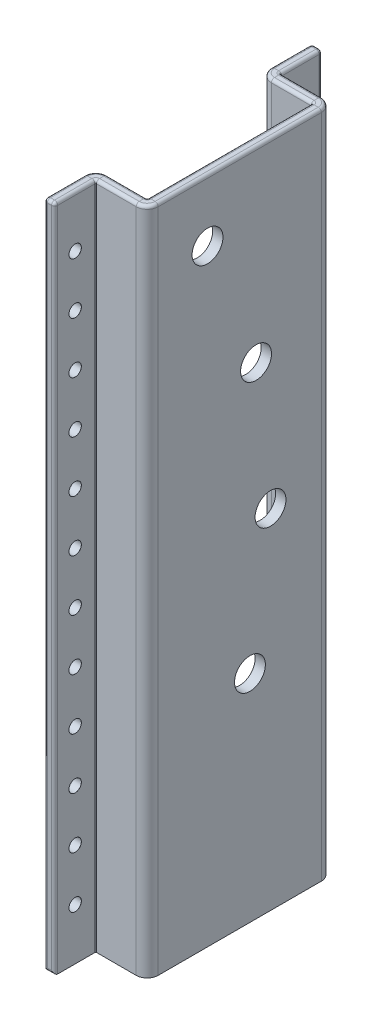
from build123d import *

# Parameters (mm, degrees)
SKETCH1_W                       = 180
SKETCH1_H                       = 650
BASE_FLANGE1_DEPTH              = 10
EDGE_FLANGE1_STRIP_W            = 41.4732
EDGE_FLANGE1_STRIP_H            = 10
EDGE_FLANGE1_STRIP_CUT_DEPTH    = 650
EDGE_FLANGE1_STRIP_2_W          = 41.4732
EDGE_FLANGE1_STRIP_2_H          = 10
EDGE_FLANGE1_STRIP_CUT_2_DEPTH  = 650
EDGE_FLANGE1_DEPTH              = 650
EDGE_FLANGE1_BEND_DEPTH         = 650
EDGE_FLANGE2_STRIP_W            = 41.4732
EDGE_FLANGE2_STRIP_H            = 10
EDGE_FLANGE2_STRIP_CUT_DEPTH    = 650
EDGE_FLANGE2_STRIP_2_W          = 41.4732
EDGE_FLANGE2_STRIP_2_H          = 10
EDGE_FLANGE2_STRIP_CUT_2_DEPTH  = 650
EDGE_FLANGE2_DEPTH              = 650
EDGE_FLANGE2_BEND_DEPTH         = 650
SKETCH18_R                      = 15
CUT_EXTRUDE1_DEPTH              = 10
M10_CLEARANCE_HOLE1_D           = 12
M10_CLEARANCE_HOLE1_CSINK_D     = 12.05
M10_CLEARANCE_HOLE1_CSINK_ANGLE = 90
FILLET1_R                       = 3


# Sheet-metal steps are written as plain solids
with BuildPart() as part:
    # Sketch1 → Base-Flange1 (new body)
    with BuildSketch(Plane(origin=(0, 0, 0), x_dir=(0, 0, -1), z_dir=(1, 0, 0))):
        Rectangle(SKETCH1_W, SKETCH1_H)
    extrude(amount=BASE_FLANGE1_DEPTH)

    # Edge-Flange1 strip (across the edge) → Edge-Flange1 strip cut (cut)
    with BuildSketch(Plane(origin=(0, -325, 90), x_dir=(0, 0, -1), z_dir=(0, 1, 0))):
        with Locations((-10, -5)):
            Rectangle(EDGE_FLANGE1_STRIP_W, EDGE_FLANGE1_STRIP_H)
    extrude(amount=EDGE_FLANGE1_STRIP_CUT_DEPTH, mode=Mode.SUBTRACT)

    # Edge-Flange1 strip 2 (across the edge) → Edge-Flange1 strip cut 2 (cut)
    with BuildSketch(Plane(origin=(0, 325, -90), x_dir=(0, 0, 1), z_dir=(0, -1, 0))):
        with Locations((-10, -5)):
            Rectangle(EDGE_FLANGE1_STRIP_2_W, EDGE_FLANGE1_STRIP_2_H)
    extrude(amount=EDGE_FLANGE1_STRIP_CUT_2_DEPTH, mode=Mode.SUBTRACT)

    # Edge-Flange1 section (across the edge) → Edge-Flange1 (add)
    with BuildSketch(Plane(origin=(0, -325, 90), x_dir=(0, 0, -1), z_dir=(0, 1, 0))):
        with BuildLine():
            Line((0, 0.7366), (0, 50))
            Line((0, 50), (10, 50))
            Line((10, 50), (10, 0.7366))
            ThreePointArc((10, 0.7366), (10.215745145, 0.215745145), (10.7366, 0))
            Line((10.7366, 0), (10.7366, -10))
            ThreePointArc((10.7366, -10), (3.144677333, -6.855322667), (0, 0.7366))
        make_face()
    extrude(amount=EDGE_FLANGE1_DEPTH)

    # Edge-Flange1 section 2 (across the edge) → Edge-Flange1 bend (add)
    with BuildSketch(Plane(origin=(0, 325, -90), x_dir=(0, 0, 1), z_dir=(0, -1, 0))):
        with BuildLine():
            Line((0, 0.7366), (0, 50))
            Line((0, 50), (10, 50))
            Line((10, 50), (10, 0.7366))
            ThreePointArc((10, 0.7366), (10.215745145, 0.215745145), (10.7366, 0))
            Line((10.7366, 0), (10.7366, -10))
            ThreePointArc((10.7366, -10), (3.144677333, -6.855322667), (0, 0.7366))
        make_face()
    extrude(amount=EDGE_FLANGE1_BEND_DEPTH)

    # Edge-Flange2 strip (across the edge) → Edge-Flange2 strip cut (cut)
    with BuildSketch(Plane(origin=(-50, 325, 90), x_dir=(1, 0, 0), z_dir=(0, -1, 0))):
        with Locations((-10, -5)):
            Rectangle(EDGE_FLANGE2_STRIP_W, EDGE_FLANGE2_STRIP_H)
    extrude(amount=EDGE_FLANGE2_STRIP_CUT_DEPTH, mode=Mode.SUBTRACT)

    # Edge-Flange2 strip 2 (across the edge) → Edge-Flange2 strip cut 2 (cut)
    with BuildSketch(Plane(origin=(-50, -325, -90), x_dir=(1, 0, 0), z_dir=(0, 1, 0))):
        with Locations((-10, -5)):
            Rectangle(EDGE_FLANGE2_STRIP_2_W, EDGE_FLANGE2_STRIP_2_H)
    extrude(amount=EDGE_FLANGE2_STRIP_CUT_2_DEPTH, mode=Mode.SUBTRACT)

    # Edge-Flange2 section (across the edge) → Edge-Flange2 (add)
    with BuildSketch(Plane(origin=(-50, 325, 90), x_dir=(1, 0, 0), z_dir=(0, -1, 0))):
        with BuildLine():
            Line((0, 0.7366), (0, 40))
            Line((0, 40), (10, 40))
            Line((10, 40), (10, 0.7366))
            ThreePointArc((10, 0.7366), (10.215745145, 0.215745145), (10.7366, 0))
            Line((10.7366, 0), (10.7366, -10))
            ThreePointArc((10.7366, -10), (3.144677333, -6.855322667), (0, 0.7366))
        make_face()
    extrude(amount=EDGE_FLANGE2_DEPTH)

    # Edge-Flange2 section 2 (across the edge) → Edge-Flange2 bend (add)
    with BuildSketch(Plane(origin=(-50, -325, -90), x_dir=(1, 0, 0), z_dir=(0, 1, 0))):
        with BuildLine():
            Line((0, 0.7366), (0, 40))
            Line((0, 40), (10, 40))
            Line((10, 40), (10, 0.7366))
            ThreePointArc((10, 0.7366), (10.215745145, 0.215745145), (10.7366, 0))
            Line((10.7366, 0), (10.7366, -10))
            ThreePointArc((10.7366, -10), (3.144677333, -6.855322667), (0, 0.7366))
        make_face()
    extrude(amount=EDGE_FLANGE2_BEND_DEPTH)

    # Sketch18 → Cut-Extrude1 (cut)
    with BuildSketch(Plane(origin=(10, 0, 0), x_dir=(0, 0, -1), z_dir=(1, 0, 0))):
        with Locations(Location((-31.365756011, 265, 0), (0, 0, 180))):
            Circle(SKETCH18_R)
        with Locations(Location((15.804715389, 143.295302131, 0), (0, 0, 180))):
            Circle(SKETCH18_R)
        with Locations(Location((29.868398264, 13.528974914, 0), (0, 0, 180))):
            Circle(SKETCH18_R)
        with Locations(Location((9.86687587, -115.455620901, 0), (0, 0, 180))):
            Circle(SKETCH18_R)
    extrude(amount=-CUT_EXTRUDE1_DEPTH, mode=Mode.SUBTRACT)

    # M10 Clearance Hole1 (through all)
    with Locations(Plane(origin=(-40, 0, 0), x_dir=(0, 0, -1), z_dir=(1, 0, 0))):
        with Locations((-110, -275), (-110, -225), (-110, -175), (-110, -125), (-110, -75), (-110, -25), (-110, 25), (-110, 75), (-110, 125), (-110, 175), (-110, 225), (-110, 275)):
            m10_clearance_hole1 = CounterSinkHole(M10_CLEARANCE_HOLE1_D / 2, M10_CLEARANCE_HOLE1_CSINK_D / 2, counter_sink_angle=M10_CLEARANCE_HOLE1_CSINK_ANGLE)

    # Mirror1: M10 Clearance Hole1 across plane
    add(m10_clearance_hole1.mirror(Plane.XY), mode=Mode.SUBTRACT)

    # Fillet1
    fillet1_edges = [part.edges().sort_by_distance(p)[0] for p in [
        (-46.855322667, 325, 83.144677333),
        (-39.784254855, 325, 90.215745145),
        (-45, 325, 130),
        (-40, 325, 110.3683),
        (-50, 0, 130),
        (-50, 325, 110.3683),
        (-40, 0, 130),
        (-45, -325, 130),
        (-46.855322667, 325, -83.144677333),
        (-39.784254855, 325, -90.215745145),
        (-45, -325, -130),
        (-40, 325, -110.3683),
        (-50, 325, -110.3683),
        (-50, 0, -130),
        (-40, 0, -130),
        (-45, 325, -130),
        (0, 325, 0),
        (10, 325, 0),
        (6.855322667, 325, 86.855322667),
        (-0.215745145, 325, 79.784254855),
        (-20, 325, 80),
        (-20, 325, 90),
        (6.855322667, 325, -86.855322667),
        (-0.215745145, 325, -79.784254855),
        (-20, 325, -80),
        (-20, 325, -90),
    ]]
    fillet(fillet1_edges, radius=FILLET1_R)


solid = part.part
